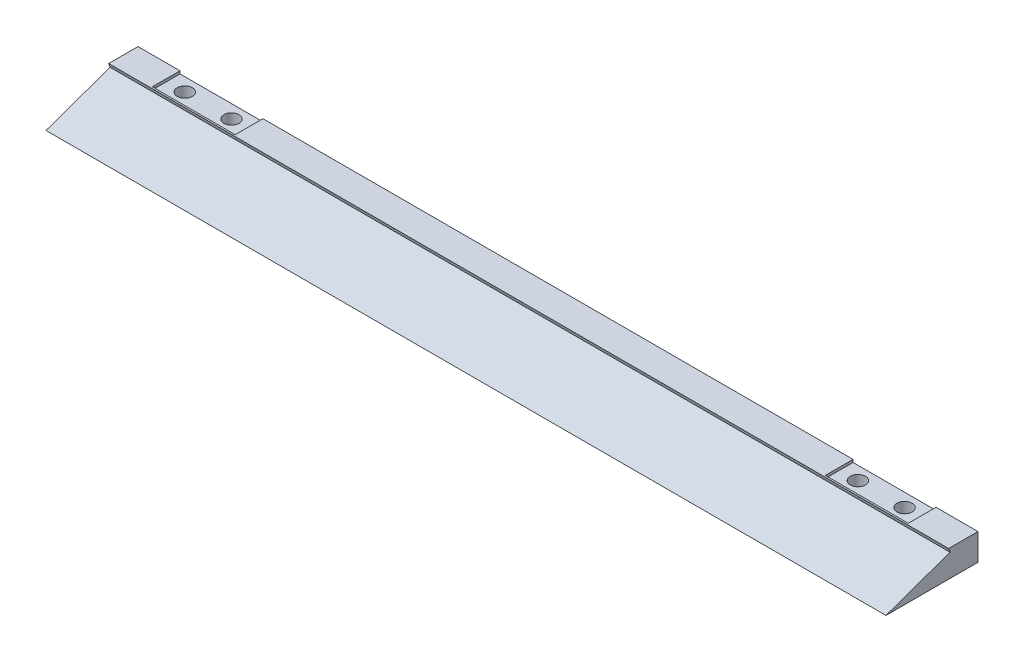
from build123d import *

# Parameters (mm, degrees)
SKETCH1_W            = 200
SKETCH1_H            = 30
BASE_DEPTH           = 6.35
WEDGECUT_REACH       = 202.662
SKETCH3_W            = 19.745999878
SKETCH3_H            = 6.604
HINGE_CUTOUT_DEPTH   = 0.635
HINGE_HOLE_CUT_REACH = 103.28
SKETCH4_R            = 1.8034
SKETCH5_W            = 5.05
SKETCH5_H            = 5.05
HINGE_NUT_CUT_DEPTH  = 2
SKETCH6_R            = 4.7625
CUT_EXTRUDE1_DEPTH   = 1.5875


with BuildPart() as part:
    # Sketch1 → Base (new body)
    with BuildSketch(Plane(origin=(0, 0, 0), x_dir=(1, 0, 0), z_dir=(0, 1, 0))):
        Rectangle(SKETCH1_W, SKETCH1_H)
    extrude(amount=BASE_DEPTH)

    # Sketch2 → WedgeCut (cut, up to next)
    with BuildSketch(Plane(origin=(100, 0, 0), x_dir=(0, 0, -1), z_dir=(1, 0, 0)), mode=Mode.PRIVATE) as wedgecut_sk1:
        Polygon((-15, 0), (-6.907470508, 0), (8.342084542, 5.407501552), (8.007874016, 6.35), (-15, 6.35), align=None)
    wedgecut_tool1 = extrude(wedgecut_sk1.sketch, amount=-WEDGECUT_REACH, mode=Mode.PRIVATE) & part.part
    add(wedgecut_tool1.solids().sort_by_distance((100, 3.70048, 5.888491))[0], mode=Mode.SUBTRACT)

    # Sketch3 → Hinge Cutout (cut)
    with BuildSketch(Plane(origin=(0, 6.35, 0), x_dir=(1, 0, 0), z_dir=(0, 1, 0))):
        with Locations((-80.127000061, 11.698)):
            Rectangle(SKETCH3_W, SKETCH3_H)
        with Locations((80.127000061, 11.698)):
            Rectangle(SKETCH3_W, SKETCH3_H)
    extrude(amount=-HINGE_CUTOUT_DEPTH, mode=Mode.SUBTRACT)

    # Sketch4 → Hinge Hole Cut (cut, up to next)
    with BuildSketch(Plane(origin=(0, 5.715, 0), x_dir=(1, 0, 0), z_dir=(0, 1, 0)), mode=Mode.PRIVATE) as hinge_hole_cut_sk1:
        with Locations((74.564400061, 11.825)):
            Circle(SKETCH4_R)
    hinge_hole_cut_tool1 = extrude(hinge_hole_cut_sk1.sketch, amount=-HINGE_HOLE_CUT_REACH, mode=Mode.PRIVATE) & part.part
    # Sketch4 → Hinge Hole Cut (cut, up to next)
    with BuildSketch(Plane(origin=(0, 5.715, 0), x_dir=(1, 0, 0), z_dir=(0, 1, 0)), mode=Mode.PRIVATE) as hinge_hole_cut_sk2:
        with Locations((85.689600061, 11.825)):
            Circle(SKETCH4_R)
    hinge_hole_cut_tool2 = extrude(hinge_hole_cut_sk2.sketch, amount=-HINGE_HOLE_CUT_REACH, mode=Mode.PRIVATE) & part.part
    hinge_hole_cut_1 = hinge_hole_cut_tool1.solids().sort_by_distance((74.5644, 5.715, -11.825))[0]
    add(hinge_hole_cut_1, mode=Mode.SUBTRACT)
    hinge_hole_cut_2 = hinge_hole_cut_tool2.solids().sort_by_distance((85.6896, 5.715, -11.825))[0]
    add(hinge_hole_cut_2, mode=Mode.SUBTRACT)
    hinge_hole_cut = hinge_hole_cut_1 + hinge_hole_cut_2  # Hinge Hole Cut as one shape, for the pattern or mirror that repeats it

    # Sketch5 → Hinge Nut Cut (cut)
    with BuildSketch(Plane.XZ):
        with Locations((74.564400061, -11.825)):
            Rectangle(SKETCH5_W, SKETCH5_H)
        with Locations((85.689600061, -11.825)):
            Rectangle(SKETCH5_W, SKETCH5_H)
    hinge_nut_cut = extrude(amount=-HINGE_NUT_CUT_DEPTH, mode=Mode.SUBTRACT)

    # Hinge Hole Mirror: Hinge Hole Cut, Hinge Nut Cut across plane
    add(hinge_hole_cut.mirror(Plane(origin=(0, 0, 0), x_dir=(0, 0, 1), z_dir=(1, 0, 0))), mode=Mode.SUBTRACT)
    add(hinge_nut_cut.mirror(Plane(origin=(0, 0, 0), x_dir=(0, 0, 1), z_dir=(1, 0, 0))), mode=Mode.SUBTRACT)

    # Sketch6 → Cut-Extrude1 (cut)
    with BuildSketch(Plane(origin=(0, 0, 0), x_dir=(-1, 0, 0), z_dir=(0, -1, 0))):
        with Locations((-80, 5)):
            Circle(SKETCH6_R)
        with Locations((-40, 5)):
            Circle(SKETCH6_R)
        with Locations((0, 5)):
            Circle(SKETCH6_R)
        with Locations((40, 5)):
            Circle(SKETCH6_R)
        with Locations((80, 5)):
            Circle(SKETCH6_R)
    extrude(amount=-CUT_EXTRUDE1_DEPTH, mode=Mode.SUBTRACT)


solid = part.part
